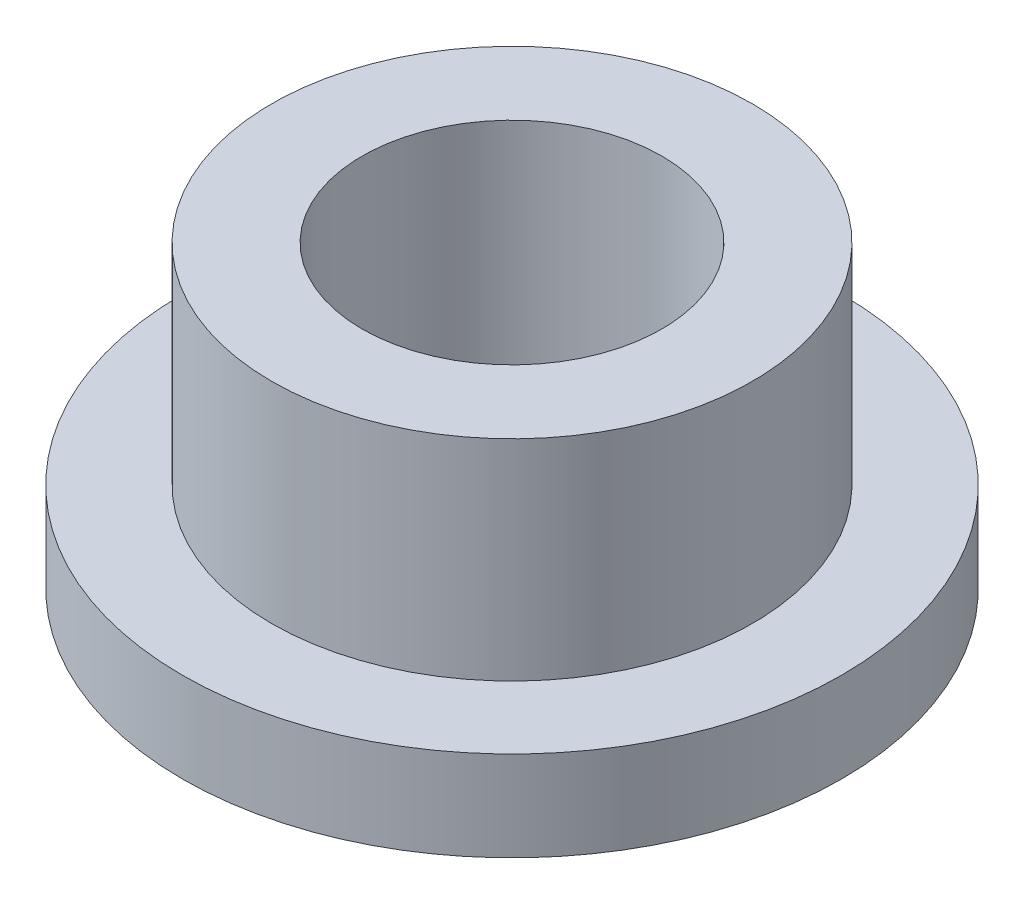
from build123d import *

# Parameters (mm, degrees)
SKETCH2_R           = 4.01
SKETCH2_R_2         = 2.5
BOSS_EXTRUDE1_DEPTH = 5
SKETCH3_R           = 5.5
SKETCH3_R_2         = 4.01
BOSS_EXTRUDE2_DEPTH = 1.5


with BuildPart() as part:
    # Sketch2 → Boss-Extrude1 (new body)
    with BuildSketch(Plane(origin=(0, 0, 0), x_dir=(1, 0, 0), z_dir=(0, 1, 0))):
        Circle(SKETCH2_R)
        Circle(SKETCH2_R_2, mode=Mode.SUBTRACT)
    extrude(amount=BOSS_EXTRUDE1_DEPTH)

    # Sketch3 → Boss-Extrude2 (add)
    with BuildSketch(Plane(origin=(0, 0, 0), x_dir=(1, 0, 0), z_dir=(0, 1, 0))):
        Circle(SKETCH3_R)
        Circle(SKETCH3_R_2, mode=Mode.SUBTRACT)
    extrude(amount=BOSS_EXTRUDE2_DEPTH)


solid = part.part
